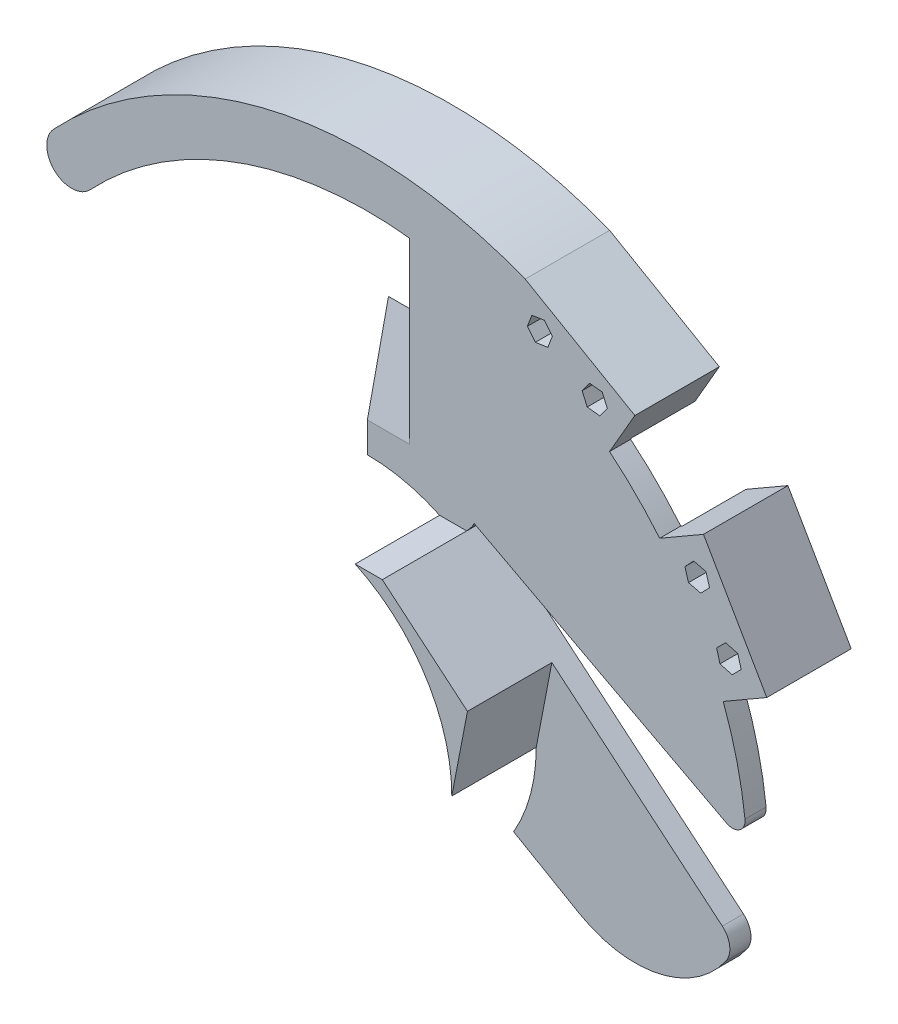
from build123d import *

# Parameters (mm, degrees)
BOSS_EXTRUDE1_DEPTH  = 5
CUT_EXTRUDE1_DEPTH   = 10
BOSS_EXTRUDE3_START  = -3
SKETCH13_R           = 2.5
BOSS_EXTRUDE3_DEPTH  = 3
CHAMFER1_SIZE        = 2
BOSS_EXTRUDE7_DEPTH  = 17
SKETCH22_R           = 1.6
CUT_EXTRUDE4_DEPTH   = 20
CUT_EXTRUDE5_DEPTH   = 7
BOSS_EXTRUDE8_START  = -20
BOSS_EXTRUDE8_DEPTH  = 20
SKETCH26_R           = 90.5
SKETCH26_R_2         = 90
CUT_EXTRUDE6_DEPTH   = 15
BOSS_EXTRUDE9_START  = 20
BOSS_EXTRUDE9_DEPTH  = 20
BOSS_EXTRUDE11_DEPTH = 20
FILLET2_R            = 6
CUT_EXTRUDE8_DEPTH   = 5
FILLET3_R            = 5
CUT_EXTRUDE9_DEPTH   = 5
FILLET4_R            = 3
CUT_EXTRUDE11_DEPTH  = 5
FILLET5_R            = 3


# Some blends are built 0.0001 mm under size
with BuildPart() as part:
    # Sketch1 → Boss-Extrude1 (new body)
    with BuildSketch(Plane.XY):
        with BuildLine():
            Line((10, 70), (0, 70))
            Line((0, 70), (0, 40))
            ThreePointArc((0, 40), (34.641016151, 20), (34.641016151, -20))
            Line((34.641016151, -20), (50.226140717, -28.998075863))
            ThreePointArc((50.226140717, -28.998075863), (74.464134482, -30.098388714), (89.334294573, -10.926290001))
            ThreePointArc((89.334294573, -10.926290001), (70.606727842, 55.809407661), (10, 89.4427191))
            Line((10, 89.4427191), (10, 70))
        make_face()
    extrude(amount=-BOSS_EXTRUDE1_DEPTH)

    # Sketch10 → Cut-Extrude1 (cut)
    with BuildSketch(Plane.ZY):
        Polygon((-5, 70), (0, 47.166644618), (0, 70), align=None)
    extrude(amount=-CUT_EXTRUDE1_DEPTH, mode=Mode.SUBTRACT)

    # Sketch13 → Boss-Extrude3 (add)
    # profile 1 of 2: a face of its own
    with BuildSketch(Plane.XY.offset(BOSS_EXTRUDE3_START)):
        with BuildLine():
            Line((37.380217316, 94.74443559), (31.380217316, 84.352130745))
            ThreePointArc((31.380217316, 84.352130745), (45, 77.942286341), (57.36097943, 69.352130745))
            Line((57.36097943, 69.352130745), (63.36097943, 79.74443559))
            Line((63.36097943, 79.74443559), (37.380217316, 94.74443559))
        make_face()
        with Locations((40.856551784, 85.765623512)):
            Circle(SKETCH13_R, mode=Mode.SUBTRACT)
        with Locations((53.846932841, 78.265623512)):
            Circle(SKETCH13_R, mode=Mode.SUBTRACT)
    # profile 2 of 2: a face of its own
    with BuildSketch(Plane.XY.offset(BOSS_EXTRUDE3_START)):
        with BuildLine():
            Line((79.611529559, 63.493885461), (69.234612109, 57.502769378))
            ThreePointArc((69.234612109, 57.502769378), (77.850059036, 45.159365674), (84.287765503, 31.552695391))
            Line((84.287765503, 31.552695391), (94.611529559, 37.513123348))
            Line((94.611529559, 37.513123348), (79.611529559, 63.493885461))
        make_face()
        with Locations((85.63271748, 40.989457815)):
            Circle(SKETCH13_R, mode=Mode.SUBTRACT)
        with Locations((78.13271748, 53.979838872)):
            Circle(SKETCH13_R, mode=Mode.SUBTRACT)
    extrude(amount=BOSS_EXTRUDE3_DEPTH)

    # Chamfer1
    chamfer1_edges = [part.edges().sort_by_distance(p)[0] for p in [
        (45, 77.942286341, -3),
    ]]
    chamfer(chamfer1_edges, length=CHAMFER1_SIZE - 0.0001)  # a hair under: the kernel refuses the full size

    # Sketch21 → Boss-Extrude7 (add)
    with BuildSketch(Plane(origin=(0, 0, -3), x_dir=(-1, 0, 0), z_dir=(0, 0, -1))):
        with BuildLine():
            Line((-32.394087652, 86.108205679), (-37.380217316, 94.74443559))
            Line((-37.380217316, 94.74443559), (-63.36097943, 79.74443559))
            Line((-63.36097943, 79.74443559), (-58.374849766, 71.108205679))
            ThreePointArc((-58.374849766, 71.108205679), (-46, 79.674337148), (-32.394087652, 86.108205679))
        make_face()
        with BuildLine():
            Line((-86.043250616, 32.566225194), (-94.611529559, 37.513123348))
            Line((-94.611529559, 37.513123348), (-79.611529559, 63.493885461))
            Line((-79.611529559, 63.493885461), (-70.991284652, 58.516984744))
            ThreePointArc((-70.991284652, 58.516984744), (-79.582170095, 46.159269957), (-86.043250616, 32.566225194))
        make_face()
    extrude(amount=BOSS_EXTRUDE7_DEPTH)

    # Sketch22 → Cut-Extrude4 (cut)
    with BuildSketch(Plane.XY):
        with Locations(Location((40.856551784, 85.765623512, 0), (0, 0, 180))):
            Circle(SKETCH22_R)
        with Locations(Location((53.846932841, 78.265623512, 0), (0, 0, 180))):
            Circle(SKETCH22_R)
        with Locations(Location((78.13271748, 53.979838872, 0), (0, 0, 180))):
            Circle(SKETCH22_R)
        with Locations(Location((85.63271748, 40.989457815, 0), (0, 0, 180))):
            Circle(SKETCH22_R)
    extrude(amount=-CUT_EXTRUDE4_DEPTH, mode=Mode.SUBTRACT)

    # Sketch24 → Cut-Extrude5 (cut)
    with BuildSketch(Plane.XY):
        Polygon((42.741480602, 83.428878621), (43.82269663, 86.229647308), (41.937767812, 88.566392198), (38.971622965, 88.102368402), (37.890406937, 85.301599716), (39.775335756, 82.964854825), align=None)
        Polygon((55.059031292, 75.518961778), (56.831660903, 77.942000695), (55.619562452, 80.688662429), (52.634834389, 81.012285245), (50.862204778, 78.589246328), (52.074303229, 75.842584594), align=None)
        Polygon((78.97688632, 51.098743194), (81.049903948, 53.270362694), (80.205735108, 56.151458371), (77.28854864, 56.860934549), (75.215531013, 54.68931505), (76.059699853, 51.808219373), align=None)
        Polygon((86.409892613, 38.089572965), (88.532678995, 40.212568798), (87.755503862, 43.112453649), (84.855542347, 43.889342666), (82.732755965, 41.766346832), (83.509931098, 38.866461981), align=None)
    extrude(amount=-CUT_EXTRUDE5_DEPTH, mode=Mode.SUBTRACT)

    # Sketch25 → Boss-Extrude8 (add)
    with BuildSketch(Plane(origin=(0, 0, -20), x_dir=(-1, 0, 0), z_dir=(0, 0, -1)).offset(BOSS_EXTRUDE8_START)):
        with BuildLine():
            Line((-86.043250616, 32.566225194), (-84.287765503, 31.552695391))
            ThreePointArc((-84.287765503, 31.552695391), (-77.850059036, 45.159365674), (-69.234612109, 57.502769378))
            Line((-69.234612109, 57.502769378), (-70.991284652, 58.516984744))
            ThreePointArc((-70.991284652, 58.516984744), (-79.582170095, 46.159269957), (-86.043250616, 32.566225194))
        make_face()
        with BuildLine():
            Line((-58.374849766, 71.108205679), (-57.36097943, 69.352130745))
            ThreePointArc((-57.36097943, 69.352130745), (-45, 77.942286341), (-31.380217316, 84.352130745))
            Line((-31.380217316, 84.352130745), (-32.394087652, 86.108205679))
            ThreePointArc((-32.394087652, 86.108205679), (-46, 79.674337148), (-58.374849766, 71.108205679))
        make_face()
    extrude(amount=BOSS_EXTRUDE8_DEPTH)

    # Sketch26 → Cut-Extrude6 (cut)
    with BuildSketch(Plane(origin=(0, 0, -5), x_dir=(-1, 0, 0), z_dir=(0, 0, -1))):
        Circle(SKETCH26_R)
        Circle(SKETCH26_R_2, mode=Mode.SUBTRACT)
    extrude(amount=CUT_EXTRUDE6_DEPTH, mode=Mode.SUBTRACT)

    # Sketch28 → Boss-Extrude9 (add)
    with BuildSketch(Plane.XY.offset(BOSS_EXTRUDE9_START)):
        with BuildLine():
            Line((23.533293218, 36.154783936), (43.701329204, 19.231792379))
            Line((43.701329204, 19.231792379), (40, 0))
            ThreePointArc((40, 0), (33.797136862, 21.395175623), (17.112323002, 36.154783936))
            Line((17.112323002, 36.154783936), (23.533293218, 36.154783936))
        make_face()
    extrude(amount=-BOSS_EXTRUDE9_DEPTH)

    # Sketch30 → Boss-Extrude11 (add)
    with BuildSketch(Plane.XY):
        with BuildLine():
            Line((31.380217316, 84.352130745), (37.380217316, 94.74443559))
            ThreePointArc((37.380217316, 94.74443559), (-25.433217284, 98.625251232), (-78.536554117, 64.8521271))
            Line((-78.536554117, 64.8521271), (-69.397791898, 57.305728157))
            ThreePointArc((-69.397791898, 57.305728157), (-23.328329719, 86.92404174), (31.380217316, 84.352130745))
        make_face()
    extrude(amount=-BOSS_EXTRUDE11_DEPTH)

    # Fillet2
    # the kernel refuses this fillet: 6 mm, written as the material it takes off along each edge
    with BuildSketch(Plane(origin=(-69.397791898, 57.305728157, 14.53079134), x_dir=(0.6605272706079757, 0.7508020543280219, 0), z_dir=(0, 0, -1))) as fillet2_piece_1:
        with BuildLine():
            CenterArc((5.815342996, -5.997066729), FILLET2_R, 91.791660849, 86.416678302)
            Line((-0.181723733, -5.809475019), (0, 0))
            ThreePointArc((0, 0), (2.813875643, -0.043999067), (5.627751287, 0))
        make_face()
    extrude(amount=49.06158268, mode=Mode.SUBTRACT)
    with BuildSketch(Plane(origin=(-78.536554117, 64.8521271, 15.946769714), x_dir=(0.6605636178718797, 0.7507700758181651, 0), z_dir=(0, 0, -1))) as fillet2_piece_2:
        with BuildLine():
            CenterArc((6.190825845, 5.99705764), FILLET2_R, 178.205565332, 93.588869337)
            Line((0.193768204, 6.184939681), (0, 0))
            ThreePointArc((0, 0), (3.189353943, -0.049947441), (6.378707886, 0))
        make_face()
    extrude(amount=51.893539428, mode=Mode.SUBTRACT)

    # Sketch31 → Cut-Extrude8 (cut)
    with BuildSketch(Plane(origin=(0, 0, 0), x_dir=(-1, 0, 0), z_dir=(0, 0, -1))):
        Polygon((-126.538851056, -27.990413584), (-128.420531953, -25.747913615), (-227.900156191, -109.221229623), (-215.044403998, -124.542118485), (-23.533293218, 36.154783936), (-24.818868437, 37.686872822), (-88.130475533, 4.238040152), align=None)
    extrude(amount=CUT_EXTRUDE8_DEPTH, mode=Mode.SUBTRACT)

    # Fillet3
    fillet3_edges = [part.edges().sort_by_distance(p)[0] for p in [
        (87.283893388, -17.338321154, -2.5),
    ]]
    fillet(fillet3_edges, radius=FILLET3_R)

    # Sketch32 → Cut-Extrude9 (cut)
    with BuildSketch(Plane.XY):
        Polygon((87.46553992, 4.589339402), (92.809930085, 1.765787441), (89.670227424, 2.292669877), align=None)
    extrude(amount=-CUT_EXTRUDE9_DEPTH, mode=Mode.SUBTRACT)

    # Fillet4
    fillet4_edges = [part.edges().sort_by_distance(p)[0] for p in [
        (89.94013986, 3.281957025, -2.5),
    ]]
    fillet(fillet4_edges, radius=FILLET4_R)

    # Sketch33 → Cut-Extrude11 (cut)
    with BuildSketch(Plane.XY):
        Polygon((24.818868437, 37.686872822), (88.601440511, 3.989219605), (89.06857455, 4.873406118), (25.286002476, 38.571059335), align=None)
    extrude(amount=-CUT_EXTRUDE11_DEPTH, mode=Mode.SUBTRACT)

    # Fillet5
    # the kernel refuses this fillet: 3 mm, written as the material it takes off along each edge
    with BuildSketch(Plane(origin=(87.631958407, 5.632400166, -16.76496935), x_dir=(0.385373580220951, 0.9227606426737577, 0), z_dir=(0, 0, 1))) as fillet5_piece_1:
        with BuildLine():
            CenterArc((3.250174857, 2.623091468), FILLET5_R, 174.818513503, 124.211713056)
            Line((0.262433961, 2.894023819), (-0.036340129, 2.921117054))
            Line((-0.036340129, 2.921117054), (-0.29877409, 0.027093235))
            Line((-0.29877409, 0.027093235), (-0.219376832, -0.204630901))
            ThreePointArc((-0.219376832, -0.204630901), (3.755091894, -0.860969557), (4.851569028, -0.262309147))
            Line((4.851569028, -0.262309147), (4.70598774, 0))
        make_face()
    extrude(amount=28.529938699, mode=Mode.SUBTRACT)


solid = part.part
